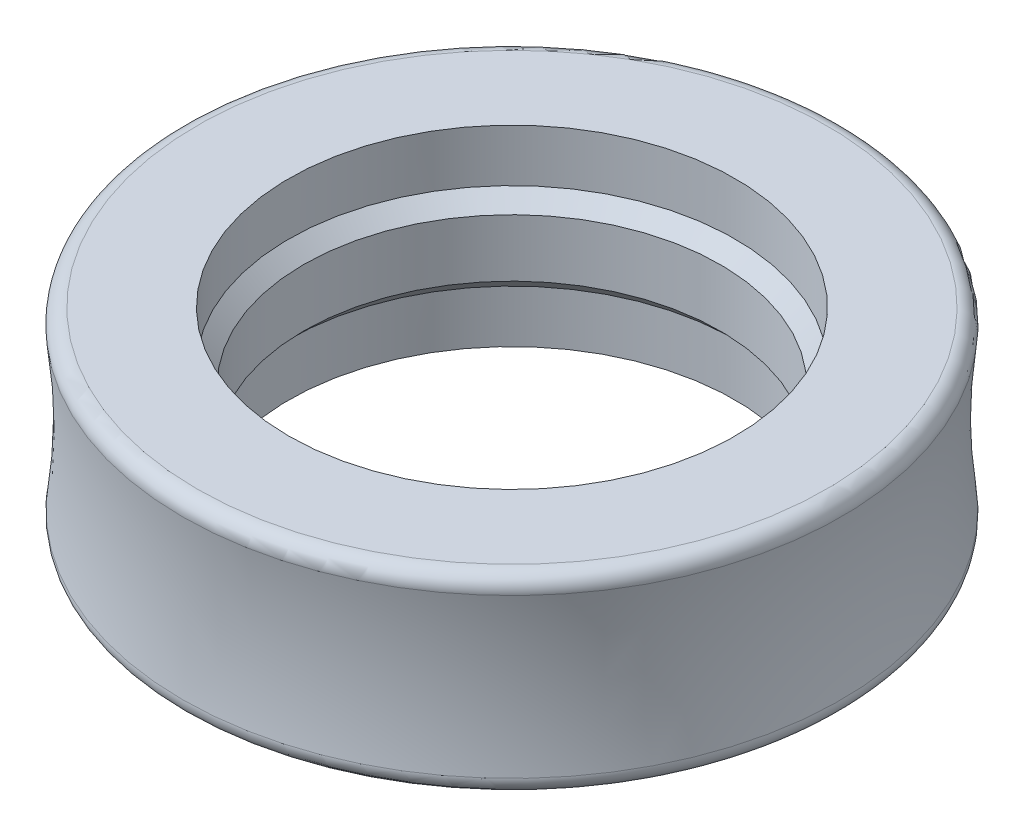
from build123d import *

# Parameters (mm, degrees)
SKETCH1_R               = 22.5
SKETCH1_R_2             = 15.125
BOSS_EXTRUDE1_DEPTH     = 6.5
SKETCH2_R               = 15.125
SKETCH2_R_2             = 14.125
BOSS_EXTRUDE2_DEPTH     = 1.95
CHAMFER1_SIZE           = 1
FILLET1_R               = 1
CUT_EXTRUDE1_DEPTH      = 33.253753798
CUT_EXTRUDE1_DEPTH_BACK = 33.253753798


with BuildPart() as part:
    # Sketch1 → Boss-Extrude1 (new, symmetric)
    with BuildSketch(Plane(origin=(0, 0, 0), x_dir=(1, 0, 0), z_dir=(0, 1, 0))):
        with Locations(Location((0, 0, 0), (0, 0, 90))):
            Circle(SKETCH1_R)
        with Locations(Location((0, 0, 0), (0, 0, 90))):
            Circle(SKETCH1_R_2, mode=Mode.SUBTRACT)
    extrude(amount=BOSS_EXTRUDE1_DEPTH, both=True)

    # Sketch2 → Boss-Extrude2 (add, symmetric)
    with BuildSketch(Plane(origin=(0, 0, 0), x_dir=(1, 0, 0), z_dir=(0, 1, 0))):
        with Locations(Location((0, 0, 0), (0, 0, 90))):
            Circle(SKETCH2_R)
        with Locations(Location((0, 0, 0), (0, 0, 270))):
            Circle(SKETCH2_R_2, mode=Mode.SUBTRACT)
    extrude(amount=BOSS_EXTRUDE2_DEPTH, both=True)

    # Sketch4 → Cut-Revolve2 (revolve, cut)
    with BuildSketch(Plane.XY, mode=Mode.PRIVATE) as cut_revolve2_sk:
        with BuildLine():
            Line((22.5, 6.5), (22.5, -6.5))
            ThreePointArc((22.5, -6.5), (21.968341744, 0), (22.5, 6.5))
        make_face()
    revolve(cut_revolve2_sk.sketch.rotate(Axis((0, 6.5, 0), (0, -1, 0)), 180), axis=Axis((0, 6.5, 0), (0, -1, 0)), mode=Mode.SUBTRACT)

    # Chamfer1
    chamfer1_edges = [part.edges().sort_by_distance(p)[0] for p in [
        (0, 1.95, 15.125),
        (0, -1.95, 15.125),
    ]]
    chamfer(chamfer1_edges, length=CHAMFER1_SIZE - 0.0001)  # a hair under: the kernel refuses the full size

    # Fillet1
    fillet1_edges = [part.edges().sort_by_distance(p)[0] for p in [
        (22.5, 6.5, 0),
        (22.5, -6.5, 0),
    ]]
    fillet(fillet1_edges, radius=FILLET1_R)

    # Sketch5 → Cut-Extrude1 (cut, two sides: drawn at the far end of the back side and taken through both)
    with BuildSketch(Plane(origin=(0, 0, 0), x_dir=(1, 0, 0), z_dir=(0, 1, 0)).offset(-CUT_EXTRUDE1_DEPTH_BACK)):
        with BuildLine():
            Line((13.892916361, 2.55), (14.908491708, 2.55))
            ThreePointArc((14.908491708, 2.55), (15.125, 0), (14.908491708, -2.55))
            Line((14.908491708, -2.55), (13.892916361, -2.55))
            ThreePointArc((13.892916361, -2.55), (14.125, 0), (13.892916361, 2.55))
        make_face()
    extrude(amount=CUT_EXTRUDE1_DEPTH + CUT_EXTRUDE1_DEPTH_BACK, mode=Mode.SUBTRACT)


solid = part.part
